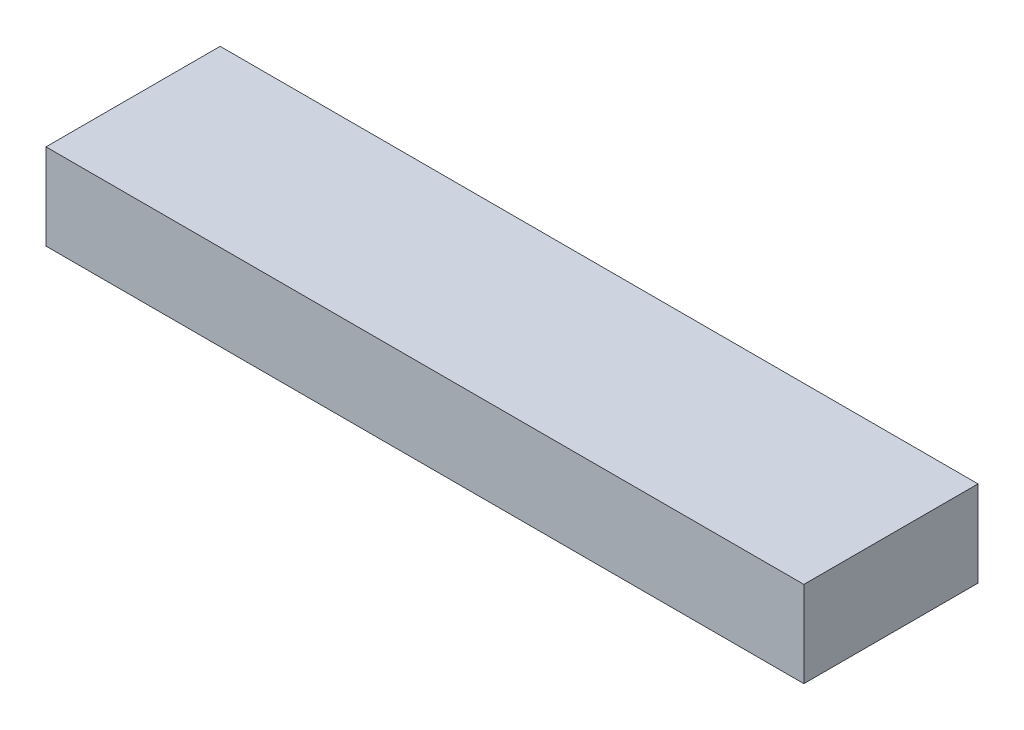
from build123d import *

# Parameters (mm, degrees)
REVOLVE1_ANGLE         = 180
SKETCH5_W              = 895.40473358
SKETCH5_H              = 205.74
BOSS_EXTRUDE1_DEPTH    = 38.1
SKETCH9_W              = 895.40473358
SKETCH9_H              = 205.74
BOSS_EXTRUDE5_DEPTH    = 101.6
FILLET1_R              = 3.175
CUT_EXTRUDE1_OUTLINE_R = 3.175
CUT_EXTRUDE1_DEPTH     = 12.7


# Read off the part's stored shape, not the designer's step: Cut-Extrude1
with BuildPart() as part:
    # Sketch4 → Revolve1 (revolve)
    with BuildSketch(Plane(origin=(0, 0, 0), x_dir=(1, 0, 0), z_dir=(0, 1, 0))):
        with BuildLine():
            Line((838.361715067, 83.82), (889.161715067, 83.82))
            Line((889.161715067, 83.82), (903.94144259, 0))
            Line((903.94144259, 0), (33.93670901, 0))
            Line((33.93670901, 0), (36.566965131, 6.35))
            Line((36.566965131, 6.35), (49.266965131, 6.35))
            Line((49.266965131, 6.35), (50.8, 15.04427278))
            add(Edge.make_bspline(
                [(50.8, 15.04427278), (51.625271193, 15.201290881), (53.251330207, 15.508536828), (57.124119543, 16.232931828), (62.146237859, 17.146971323), (68.468865546, 18.271630494), (77.104805357, 19.759299021), (87.563136705, 21.501230362), (99.596217659, 23.425244589), (111.661947143, 25.278307663), (121.972557789, 26.811740179), (132.310247749, 28.314515819), (142.640819969, 29.78211892), (154.707618563, 31.451577511), (168.50058462, 33.303205201), (182.303059594, 35.104467069), (196.110093108, 36.858246399), (213.376725128, 38.995527561), (234.106301617, 41.477276739), (258.304205533, 44.261664544), (282.515559062, 46.924534133), (303.276895107, 49.126678738), (324.044555274, 51.267518561), (344.81831943, 53.348832955), (369.062594865, 55.693564026), (396.78074426, 58.263492413), (424.508528664, 60.72715323), (452.245340769, 63.087037809), (479.990655319, 65.344703609), (507.744043491, 67.50088036), (535.505139038, 69.555419915), (570.215765491, 71.995364991), (611.882821301, 74.714193718), (660.514345839, 77.568482026), (705.693597747, 79.827536832), (740.458993877, 81.299277883), (764.800431333, 82.180653766), (778.711441945, 82.6371517), (793.992125907, 83.081992109), (808.219629905, 83.426024247), (821.393522916, 83.6742739), (831.089402446, 83.787712376), (835.937585304, 83.82), (838.361715067, 83.82)],
                knots=[0.061800805, 0.061800805, 0.061800805, 0.061800805, 0.061800805, 0.066047901, 0.070294997, 0.078789189, 0.087283381, 0.095777573, 0.112282002, 0.12878643, 0.145290859, 0.153543073, 0.161795288, 0.178299717, 0.194804145, 0.211308574, 0.227813002, 0.244317431, 0.26082186, 0.293830717, 0.326839575, 0.359848434, 0.376352863, 0.392857292, 0.42586615, 0.458875008, 0.491883866, 0.524892724, 0.557901583, 0.590910441, 0.623919299, 0.656928157, 0.689937015, 0.755954731, 0.821972448, 0.887990163, 0.904494593, 0.920999022, 0.937503451, 0.95400788, 0.97700394, 0.98850197, 1, 1, 1, 1, 1], degree=4))
        make_face()
    revolve(axis=Axis((0, 0, 0), (1, 0, 0)), revolution_arc=REVOLVE1_ANGLE)

    # Sketch5 → Boss-Extrude1 (add)
    with BuildSketch(Plane.XZ):
        with Locations((468.9390758, 0)):
            Rectangle(SKETCH5_W, SKETCH5_H)
    extrude(amount=BOSS_EXTRUDE1_DEPTH)


with BuildPart() as body_2:
    # Sketch9 → Boss-Extrude5 (new body)
    with BuildSketch(Plane(origin=(0, 0, 0), x_dir=(1, 0, 0), z_dir=(0, 1, 0))):
        with Locations((468.9390758, 0)):
            Rectangle(SKETCH9_W, SKETCH9_H)
    extrude(amount=BOSS_EXTRUDE5_DEPTH)

    # Combine1: cut part
    add(part.part, mode=Mode.SUBTRACT)

    # Fillet1
    fillet1_edges = [body_2.edges().sort_by_distance(p)[0] for p in [
        (889.161715067, 83.82, 0),
        (50.8, 15.04427278, 0),
        (36.566965131, 6.35, 0),
    ]]
    fillet(fillet1_edges, radius=FILLET1_R)

    # Cut-Extrude1 outline → Cut-Extrude1 (cut)
    with BuildSketch(Plane(origin=(0, 0, 0), x_dir=(1, 0, 0), z_dir=(0, 1, 0))):
        with Locations((65.68670901, 35.56)):
            Circle(CUT_EXTRUDE1_OUTLINE_R)
        with Locations((402.23670901, 85.09)):
            Circle(CUT_EXTRUDE1_OUTLINE_R)
        with Locations((630.83670901, 93.345)):
            Circle(CUT_EXTRUDE1_OUTLINE_R)
        with Locations((211.73670901, 61.976)):
            Circle(CUT_EXTRUDE1_OUTLINE_R)
        with Locations((65.68670901, 85.09)):
            Circle(CUT_EXTRUDE1_OUTLINE_R)
        with Locations((859.43670901, 93.345)):
            Circle(CUT_EXTRUDE1_OUTLINE_R)
    extrude(amount=CUT_EXTRUDE1_DEPTH, mode=Mode.SUBTRACT)


solid = body_2.part
